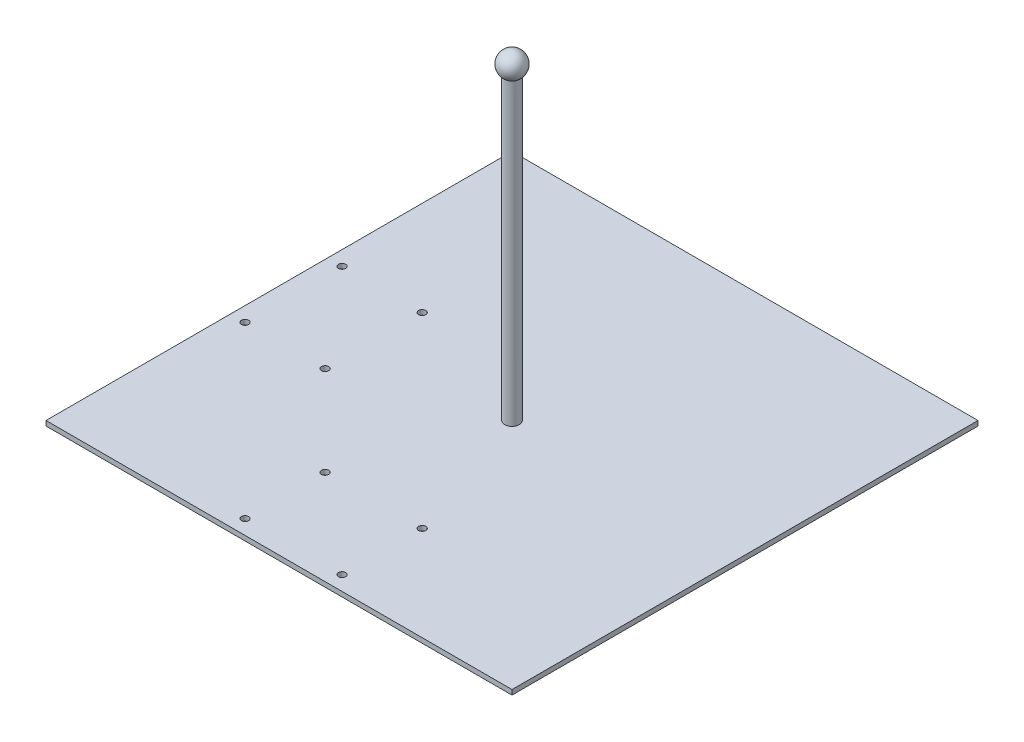
from build123d import *

# Parameters (mm, degrees)
SKETCH1_W                        = 609.6
SKETCH1_H                        = 609.6
BOSS_EXTRUDE1_DEPTH              = 6.35
F_3_8_0_375_DIAMETER_HOLE1_D     = 9.525
F_3_8_0_375_DIAMETER_HOLE1_DEPTH = 11.684
F_3_8_0_375_DIAMETER_HOLE1_TIP   = 2.861598698
SKETCH4_R                        = 9.525
BOSS_EXTRUDE2_DEPTH              = 391.16


with BuildPart() as part:
    # Sketch1 → Boss-Extrude1 (new body)
    with BuildSketch(Plane(origin=(0, 0, 0), x_dir=(1, 0, 0), z_dir=(0, 1, 0))):
        Rectangle(SKETCH1_W, SKETCH1_H)
    extrude(amount=BOSS_EXTRUDE1_DEPTH)

    # 3/8 (0.375) Diameter Hole1
    with Locations(Plane(origin=(0, 6.35, 0), x_dir=(1, 0, 0), z_dir=(0, 1, 0))):
        with Locations((-63.5, -285.75), (63.5, -285.75), (-285.75, 63.5), (-285.75, -63.5), (-63.5, -180.975), (63.5, -180.975), (-180.975, -63.5), (-180.975, 63.5)):
            Hole(F_3_8_0_375_DIAMETER_HOLE1_D / 2, depth=F_3_8_0_375_DIAMETER_HOLE1_DEPTH)
            with Locations((0, 0, -(F_3_8_0_375_DIAMETER_HOLE1_DEPTH + F_3_8_0_375_DIAMETER_HOLE1_TIP / 2))):  # 118° drill point
                Cone(0, F_3_8_0_375_DIAMETER_HOLE1_D / 2, F_3_8_0_375_DIAMETER_HOLE1_TIP, mode=Mode.SUBTRACT)

    # Sketch4 → Boss-Extrude2 (add)
    with BuildSketch(Plane(origin=(0, 6.35, 0), x_dir=(1, 0, 0), z_dir=(0, 1, 0))):
        Circle(SKETCH4_R)
    extrude(amount=BOSS_EXTRUDE2_DEPTH)

    # Sketch5 → Revolve3 (revolve)
    with BuildSketch(Plane.XY):
        with BuildLine():
            Line((0, 426.085), (0, 394.335))
            ThreePointArc((0, 394.335), (-15.875, 410.21), (0, 426.085))
        make_face()
    revolve(axis=Axis((0, 599.823656089, 0), (0, -1, 0)))


solid = part.part
